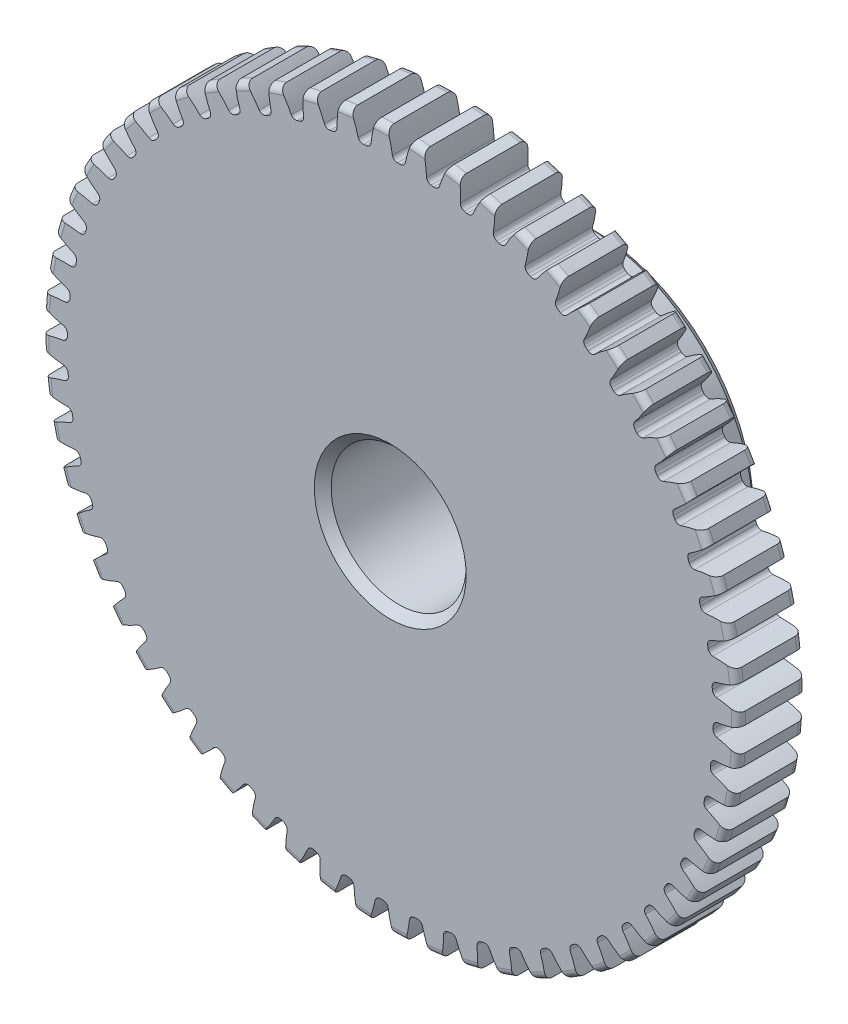
from build123d import *
from OCP.BRepAlgoAPI import BRepAlgoAPI_Cut
from OCP.TopTools import TopTools_ListOfShape

# Parameters (mm, degrees)
SKETCH1_R           = 16.383
BOSS_EXTRUDE1_DEPTH = 3.175
SKETCH2_W           = 6.35
SKETCH2_H           = 7.9375
FILLET2_R           = 0.32766
CUT_EXTRUDE1_DEPTH  = 26.050568981
FILLET1_R           = 0.2493645
CIRPATTERN1_START   = -4
CIRPATTERN1_DEPTH   = 5
SKETCH5_R           = 3.175
CUT_EXTRUDE2_DEPTH  = 26.049683755
CHAMFER1_SIZE       = 0.396875


with BuildPart() as part:
    # Sketch1 → Boss-Extrude1 (new body)
    with BuildSketch(Plane.XY):
        Circle(SKETCH1_R)
    extrude(amount=-BOSS_EXTRUDE1_DEPTH)

    # Sketch2 → Revolve1 (revolve)
    with BuildSketch(Plane(origin=(0, 0, 0), x_dir=(0, 0, -1), z_dir=(1, 0, 0)), mode=Mode.PRIVATE) as revolve1_sk:
        with Locations((6.35, 3.96875)):
            Rectangle(SKETCH2_W, SKETCH2_H)
    revolve(revolve1_sk.sketch.rotate(Axis((0, 0, -3.175), (0, 0, -1)), 90), axis=Axis((0, 0, -3.175), (0, 0, -1)))

    # Fillet2
    fillet2_edges = [part.edges().sort_by_distance(p)[0] for p in [
        (-16.383, 0, 0),
        (-16.383, 0, -3.175),
        (-7.9375, 0, -3.175),
    ]]
    fillet(fillet2_edges, radius=FILLET2_R)

    # Sketch4 → Cut-Extrude1 (cut, through all)
    with BuildSketch(Plane.XY):
        with BuildLine():
            Line((0.099855881, 15.369019402), (0.099855881, 15.192046832))
            ThreePointArc((0.099855881, 15.192046832), (0.397690945, 15.187168928), (0.695373125, 15.176452628))
            Line((0.695373125, 15.176452628), (0.704635175, 15.353182661))
            add(Edge.make_bspline(
                [(2.551287118, 18.556321877), (1.080582249, 17.17635081), (0.704635175, 15.353182661)],
                knots=[0, 0, 0, 1, 1, 1], degree=2))
            ThreePointArc((2.551287118, 18.556321877), (0.490318621, 18.72446889), (-1.576625532, 18.664415327))
            add(Edge.make_bspline(
                [(-1.576625532, 18.664415327), (-0.180158497, 17.209364545), (0.099855881, 15.369019402)],
                knots=[0, 0, 0, 1, 1, 1], degree=2))
        make_face()
    extrude(amount=-CUT_EXTRUDE1_DEPTH, mode=Mode.SUBTRACT)

    # Fillet1
    # the kernel refuses this fillet: 0.2493645 mm, written as the material it adds along each edge
    with BuildSketch(Plane(origin=(0.695373125, 15.176452628, 0), x_dir=(0.05233607851531666, 0.9986295283465428, 0), z_dir=(0, 0, -1))) as fillet1_piece_1:
        with BuildLine():
            CenterArc((0.24596039, -0.239631664), FILLET1_R, 106.060638115, 72.679609329)
            Line((-0.003343838, -0.234149371), (-0.008329923, -0.234039725))
            ThreePointArc((-0.008329923, -0.234039725), (-0.006207551, -0.117009913), (-0.004987182, 3.278e-05))
            Line((-0.004987182, 3.278e-05), (0, 0.00498729))
            ThreePointArc((0, 0.00498729), (0.088486285, 0.00498729), (0.175592813, 0.004792633))
            Line((0.175592813, 0.004792633), (0.17697257, 0))
        make_face()
    extrude(amount=3.175)
    with BuildSketch(Plane(origin=(0.099855881, 15.192046832, 0), x_dir=(0, 1, 0), z_dir=(0, 0, -1))) as fillet1_piece_2:
        with BuildLine():
            CenterArc((0.24596039, 0.239631664), FILLET1_R, 181.259752555, 72.679609329)
            Line((-0.003343838, 0.234149371), (-0.008329923, 0.234039725))
            ThreePointArc((-0.008329923, 0.234039725), (-0.006207551, 0.117009913), (-0.004987182, -3.278e-05))
            Line((-0.004987182, -3.278e-05), (0, -0.00498729))
            ThreePointArc((0, -0.00498729), (0.088486285, -0.00498729), (0.175592813, -0.004792633))
            Line((0.175592813, -0.004792633), (0.17697257, 0))
        make_face()
    extrude(amount=3.175)


with BuildPart() as cirpattern1_tool:
    # CirPattern1: read off the stored shape, not the designer's step
    # CirPattern1 outline → CirPattern1 (new body)
    with BuildSketch(Plane.XY.offset(CIRPATTERN1_START)):
        with BuildLine():
            ThreePointArc((-1.128460949, 15.150407058), (-0.984704773, 15.209746121), (-0.90406948, 15.342730752))
            add(Edge.make_bspline(
                [(-0.90406948, 15.342730752), (-0.85205746, 15.868335896), (-0.708667271, 16.367669957)],
                knots=[0, 0, 0, 0.283730871, 0.283730871, 0.283730871], degree=2))
            ThreePointArc((-0.708667271, 16.367669957), (-1.285394365, 16.332496756), (-1.860522814, 16.277012742))
            add(Edge.make_bspline(
                [(-1.860522814, 16.277012742), (-1.640785483, 15.806261703), (-1.50719112, 15.295264087)],
                knots=[0.716269129, 0.716269129, 0.716269129, 1, 1, 1], degree=2))
            ThreePointArc((-1.50719112, 15.295264087), (-1.406745216, 15.176530844), (-1.255476247, 15.140410745))
            ThreePointArc((-1.255476247, 15.140410745), (-1.191979077, 15.145542051), (-1.128460949, 15.150407058))
        make_face()
        with BuildLine():
            add(Edge.make_bspline(
                [(2.3056197, 15.195421888), (2.465774586, 15.698727391), (2.709848744, 16.157337308)],
                knots=[0, 0, 0, 0.283730871, 0.283730871, 0.283730871], degree=2))
            ThreePointArc((2.709848744, 16.157337308), (2.138411602, 16.242841034), (1.564315314, 16.308145407))
            add(Edge.make_bspline(
                [(1.564315314, 16.308145407), (1.681376213, 15.801995445), (1.70580884, 15.274388524)],
                knots=[0.716269129, 0.716269129, 0.716269129, 1, 1, 1], degree=2))
            ThreePointArc((1.70580884, 15.274388524), (1.77937373, 15.137366009), (1.919827319, 15.070584634))
            ThreePointArc((1.919827319, 15.070584634), (1.983003782, 15.062402004), (2.046145378, 15.053954538))
            ThreePointArc((2.046145378, 15.053954538), (2.199097422, 15.08210831), (2.3056197, 15.195421888))
        make_face()
        with BuildLine():
            add(Edge.make_bspline(
                [(3.881343372, 14.871176893), (4.093230665, 15.354984492), (4.383905549, 15.785569399)],
                knots=[0, 0, 0, 0.283730871, 0.283730871, 0.283730871], degree=2))
            ThreePointArc((4.383905549, 15.785569399), (3.824536372, 15.930336174), (3.26041121, 16.055292205))
            add(Edge.make_bspline(
                [(3.26041121, 16.055292205), (3.323923758, 15.539678789), (3.2930726, 15.012408248)],
                knots=[0.716269129, 0.716269129, 0.716269129, 1, 1, 1], degree=2))
            ThreePointArc((3.2930726, 15.012408248), (3.351911742, 14.868446732), (3.484615356, 14.787349795))
            ThreePointArc((3.484615356, 14.787349795), (3.546590414, 14.772608252), (3.608503113, 14.757606968))
            ThreePointArc((3.608503113, 14.757606968), (3.76356014, 14.769618669), (3.881343372, 14.871176893))
        make_face()
        with BuildLine():
            add(Edge.make_bspline(
                [(5.414542235, 14.384000172), (5.675840451, 14.843009169), (6.009931367, 15.240851488)],
                knots=[0, 0, 0, 0.283730871, 0.283730871, 0.283730871], degree=2))
            ThreePointArc((6.009931367, 15.240851488), (5.468758721, 15.443295217), (4.920785358, 15.626533862))
            add(Edge.make_bspline(
                [(4.920785358, 15.626533862), (4.9300537, 15.10710616), (4.844256768, 14.585948887)],
                knots=[0.716269129, 0.716269129, 0.716269129, 1, 1, 1], degree=2))
            ThreePointArc((4.844256768, 14.585948887), (4.887725507, 14.436625642), (5.011225219, 14.342101657))
            ThreePointArc((5.011225219, 14.342101657), (5.07131986, 14.320962713), (5.131325334, 14.299571968))
            ThreePointArc((5.131325334, 14.299571968), (5.286788507, 14.295309995), (5.414542235, 14.384000172))
        make_face()
        with BuildLine():
            add(Edge.make_bspline(
                [(6.88841824, 13.739229335), (7.196264542, 14.168410732), (7.570111119, 14.529151619)],
                knots=[0, 0, 0, 0.283730871, 0.283730871, 0.283730871], degree=2))
            ThreePointArc((7.570111119, 14.529151619), (7.053064206, 14.787054285), (6.527246352, 15.026567944))
            add(Edge.make_bspline(
                [(6.527246352, 15.026567944), (6.482168941, 14.509016915), (6.342366245, 13.999682817)],
                knots=[0.716269129, 0.716269129, 0.716269129, 1, 1, 1], degree=2))
            ThreePointArc((6.342366245, 13.999682817), (6.369988328, 13.84663386), (6.482931049, 13.739718453))
            ThreePointArc((6.482931049, 13.739718453), (6.540486864, 13.712413709), (6.59792768, 13.684867865))
            ThreePointArc((6.59792768, 13.684867865), (6.752093712, 13.664378913), (6.88841824, 13.739229335))
        make_face()
        with BuildLine():
            add(Edge.make_bspline(
                [(8.286823293, 12.943928626), (8.637844853, 13.338580221), (9.047351149, 13.658267324)],
                knots=[0, 0, 0, 0.283730871, 0.283730871, 0.283730871], degree=2))
            ThreePointArc((9.047351149, 13.658267324), (8.560094843, 13.968803293), (8.062193469, 14.261967803))
            add(Edge.make_bspline(
                [(8.062193469, 14.261967803), (7.963264183, 13.751963844), (7.77098743, 13.260033293)],
                knots=[0.716269129, 0.716269129, 0.716269129, 1, 1, 1], degree=2))
            ThreePointArc((7.77098743, 13.260033293), (7.782460224, 13.10493546), (7.88360853, 12.986800017))
            ThreePointArc((7.88360853, 12.986800017), (7.937994925, 12.953628631), (7.992241749, 12.920229486))
            ThreePointArc((7.992241749, 12.920229486), (8.143421565, 12.883738036), (8.286823293, 12.943928626))
        make_face()
        with BuildLine():
            add(Edge.make_bspline(
                [(9.594436176, 12.006811527), (9.984787128, 12.362609435), (10.425466507, 12.637740194)],
                knots=[0, 0, 0, 0.283730871, 0.283730871, 0.283730871], degree=2))
            ThreePointArc((10.425466507, 12.637740194), (9.973339291, 12.997507168), (9.508809508, 13.341110558))
            add(Edge.make_bspline(
                [(9.508809508, 13.341110558), (9.357112236, 12.84424138), (9.114468051, 12.375104069)],
                knots=[0.716269129, 0.716269129, 0.716269129, 1, 1, 1], degree=2))
            ThreePointArc((9.114468051, 12.375104069), (9.109665858, 12.219656645), (9.197911546, 12.091595483))
            ThreePointArc((9.197911546, 12.091595483), (9.248532653, 12.052920887), (9.298991146, 12.014034368))
            ThreePointArc((9.298991146, 12.014034368), (9.445528388, 11.961940229), (9.594436176, 12.006811527))
        make_face()
        with BuildLine():
            add(Edge.make_bspline(
                [(10.796930408, 10.938145288), (11.222333985, 11.251191312), (11.689358273, 11.478751338)],
                knots=[0, 0, 0, 0.283730871, 0.283730871, 0.283730871], degree=2))
            ThreePointArc((11.689358273, 11.478751338), (11.277313746, 11.883807635), (10.85124504, 12.274085314))
            add(Edge.make_bspline(
                [(10.85124504, 12.274085314), (10.648441809, 11.795794719), (10.358088652, 11.354590615)],
                knots=[0.716269129, 0.716269129, 0.716269129, 1, 1, 1], degree=2))
            ThreePointArc((10.358088652, 11.354590615), (10.337064086, 11.200496714), (10.411440319, 11.063912899))
            ThreePointArc((10.411440319, 11.063912899), (10.457741522, 11.02015882), (10.50385885, 10.976210977))
            ThreePointArc((10.50385885, 10.976210977), (10.644148025, 10.909084901), (10.796930408, 10.938145288))
        make_face()
        with BuildLine():
            add(Edge.make_bspline(
                [(11.881131211, 9.74963844), (12.336926603, 10.016502783), (12.825178982, 10.193998881)],
                knots=[0, 0, 0, 0.283730871, 0.283730871, 0.283730871], degree=2))
            ThreePointArc((12.825178982, 10.193998881), (12.457731591, 10.639906618), (12.074792061, 11.072582622))
            add(Edge.make_bspline(
                [(12.074792061, 11.072582622), (11.823104826, 10.618110863), (11.488223867, 10.20967389)],
                knots=[0.716269129, 0.716269129, 0.716269129, 1, 1, 1], degree=2))
            ThreePointArc((11.488223867, 10.20967389), (11.451207276, 10.058621797), (11.510899172, 9.915011769))
            ThreePointArc((11.510899172, 9.915011769), (11.552373186, 9.866657586), (11.593644078, 9.818129921))
            ThreePointArc((11.593644078, 9.818129921), (11.726148148, 9.736707357), (11.881131211, 9.74963844))
        make_face()
        with BuildLine():
            add(Edge.make_bspline(
                [(12.835159855, 8.454312513), (13.316353272, 8.672071354), (13.820484348, 8.797558838)],
                knots=[0, 0, 0, 0.283730871, 0.283730871, 0.283730871], degree=2))
            ThreePointArc((13.820484348, 8.797558838), (13.501659923, 9.279432557), (13.166045133, 9.749766398))
            add(Edge.make_bspline(
                [(13.166045133, 9.749766398), (12.868231432, 9.324092762), (12.492491697, 8.952897842)],
                knots=[0.716269129, 0.716269129, 0.716269129, 1, 1, 1], degree=2))
            ThreePointArc((12.492491697, 8.952897842), (12.439888644, 8.806542516), (12.484242206, 8.657479696))
            ThreePointArc((12.484242206, 8.657479696), (12.520434632, 8.605055187), (12.556406915, 8.552479378))
            ThreePointArc((12.556406915, 8.552479378), (12.679674139, 8.457652409), (12.835159855, 8.454312513))
        make_face()
        with BuildLine():
            add(Edge.make_bspline(
                [(13.648563801, 7.066359369), (14.149883187, 7.232626896), (14.664369594, 7.3047309)],
                knots=[0, 0, 0, 0.283730871, 0.283730871, 0.283730871], degree=2))
            ThreePointArc((14.664369594, 7.3047309), (14.397661243, 7.817291092), (14.113048259, 8.320129692))
            add(Edge.make_bspline(
                [(14.113048259, 8.320129692), (13.772371002, 7.927917949), (13.359889173, 7.598031971)],
                knots=[0.716269129, 0.716269129, 0.716269129, 1, 1, 1], degree=2))
            ThreePointArc((13.359889173, 7.598031971), (13.292275988, 7.457976911), (13.320805269, 7.305094464))
            ThreePointArc((13.320805269, 7.305094464), (13.351319576, 7.249174003), (13.381599131, 7.193126083))
            ThreePointArc((13.381599131, 7.193126083), (13.494278967, 7.085933652), (13.648563801, 7.066359369))
        make_face()
        with BuildLine():
            add(Edge.make_bspline(
                [(14.312431226, 5.600985713), (14.828384021, 5.713940264), (15.347588939, 5.731870801)],
                knots=[0, 0, 0, 0.283730871, 0.283730871, 0.283730871], degree=2))
            ThreePointArc((15.347588939, 5.731870801), (15.135918773, 6.269501749), (14.905425876, 6.799335905))
            add(Edge.make_bspline(
                [(14.905425876, 6.799335905), (14.525617592, 6.444883209), (14.080912909, 6.159920473)],
                knots=[0.716269129, 0.716269129, 0.716269129, 1, 1, 1], degree=2))
            ThreePointArc((14.080912909, 6.159920473), (13.999030375, 6.027700152), (14.011422802, 5.872673088))
            ThreePointArc((14.011422802, 5.872673088), (14.035924669, 5.813869352), (14.060179746, 5.754963392))
            ThreePointArc((14.060179746, 5.754963392), (14.16103765, 5.636579923), (14.312431226, 5.600985713))
        make_face()
        with BuildLine():
            add(Edge.make_bspline(
                [(14.81948866, 4.074246485), (15.344421977, 4.132650507), (15.862656887, 4.096211126)],
                knots=[0, 0, 0, 0.283730871, 0.283730871, 0.283730871], degree=2))
            ThreePointArc((15.862656887, 4.096211126), (15.70834401, 4.653022433), (15.534496527, 5.204047171))
            add(Edge.make_bspline(
                [(15.534496527, 5.204047171), (15.119718477, 4.89123698), (14.647663215, 4.654319596)],
                knots=[0.716269129, 0.716269129, 0.716269129, 1, 1, 1], degree=2))
            ThreePointArc((14.647663215, 4.654319596), (14.552408456, 4.531382646), (14.548528255, 4.375909476))
            ThreePointArc((14.548528255, 4.375909476), (14.566749234, 4.314866731), (14.58471409, 4.253748118))
            ThreePointArc((14.58471409, 4.253748118), (14.672645042, 4.125470644), (14.81948866, 4.074246485))
        make_face()
        with BuildLine():
            add(Edge.make_bspline(
                [(15.164180675, 2.502868961), (15.692343235, 2.506082566), (16.203930247, 2.415672505)],
                knots=[0, 0, 0, 0.283730871, 0.283730871, 0.283730871], degree=2))
            ThreePointArc((16.203930247, 2.415672505), (16.108665343, 2.98556363), (15.993367984, 3.551741806))
            add(Edge.make_bspline(
                [(15.993367984, 3.551741806), (15.548164562, 3.284001334), (15.053930658, 3.09772502)],
                knots=[0.716269129, 0.716269129, 0.716269129, 1, 1, 1], degree=2))
            ThreePointArc((15.053930658, 3.09772502), (14.946347304, 2.985418366), (14.926236988, 2.831202485))
            ThreePointArc((14.926236988, 2.831202485), (14.937977446, 2.768589527), (14.949455254, 2.70592789))
            ThreePointArc((14.949455254, 2.70592789), (15.023495864, 2.569161846), (15.164180675, 2.502868961))
        make_face()
        with BuildLine():
            add(Edge.make_bspline(
                [(15.342730752, 0.90406948), (15.868335896, 0.85205746), (16.367669957, 0.708667271)],
                knots=[0, 0, 0, 0.283730871, 0.283730871, 0.283730871], degree=2))
            ThreePointArc((16.367669957, 0.708667271), (16.332496767, 1.285394366), (16.277012753, 1.860522815))
            add(Edge.make_bspline(
                [(16.277012753, 1.860522815), (15.806261703, 1.640785483), (15.295264087, 1.50719112)],
                knots=[0.716269129, 0.716269129, 0.716269129, 1, 1, 1], degree=2))
            ThreePointArc((15.295264087, 1.50719112), (15.176530844, 1.406745216), (15.140410745, 1.255476247))
            ThreePointArc((15.140410745, 1.255476247), (15.145542051, 1.191979078), (15.150407058, 1.12846095))
            ThreePointArc((15.150407058, 1.12846095), (15.209746121, 0.984704773), (15.342730752, 0.90406948))
        make_face()
        with BuildLine():
            add(Edge.make_bspline(
                [(15.353182661, -0.704635175), (15.870471748, -0.811302966), (16.352082049, -1.00610227)],
                knots=[0, 0, 0, 0.283730871, 0.283730871, 0.283730871], degree=2))
            ThreePointArc((16.352082049, -1.00610227), (16.377385939, -0.428857947), (16.382323165, 0.148919547))
            add(Edge.make_bspline(
                [(16.382323165, 0.148919547), (15.891182132, -0.020407157), (15.369019402, -0.099855881)],
                knots=[0.716269129, 0.716269129, 0.716269129, 1, 1, 1], degree=2))
            ThreePointArc((15.369019402, -0.099855881), (15.240437136, -0.187340528), (15.188702994, -0.334005252))
            ThreePointArc((15.188702994, -0.334005252), (15.187168928, -0.397690945), (15.185367832, -0.461369645))
            ThreePointArc((15.185367832, -0.461369645), (15.229355217, -0.610540931), (15.353182661, -0.704635175))
        make_face()
        with BuildLine():
            add(Edge.make_bspline(
                [(15.195421888, -2.3056197), (15.698727391, -2.465774586), (16.157337308, -2.709848744)],
                knots=[0, 0, 0, 0.283730871, 0.283730871, 0.283730871], degree=2))
            ThreePointArc((16.157337308, -2.709848744), (16.242841043, -2.138411603), (16.308145416, -1.564315315))
            add(Edge.make_bspline(
                [(16.308145416, -1.564315315), (15.801995445, -1.681376213), (15.274388524, -1.70580884)],
                knots=[0.716269129, 0.716269129, 0.716269129, 1, 1, 1], degree=2))
            ThreePointArc((15.274388524, -1.70580884), (15.137366009, -1.77937373), (15.070584634, -1.919827319))
            ThreePointArc((15.070584634, -1.919827319), (15.062402004, -1.983003782), (15.053954538, -2.046145378))
            ThreePointArc((15.053954538, -2.046145378), (15.08210831, -2.199097422), (15.195421888, -2.3056197))
        make_face()
        with BuildLine():
            add(Edge.make_bspline(
                [(14.871176893, -3.881343372), (15.354984492, -4.093230665), (15.785569399, -4.383905549)],
                knots=[0, 0, 0, 0.283730871, 0.283730871, 0.283730871], degree=2))
            ThreePointArc((15.785569399, -4.383905549), (15.930336181, -3.824536374), (16.055292213, -3.260411211))
            add(Edge.make_bspline(
                [(16.055292213, -3.260411211), (15.539678789, -3.323923758), (15.012408248, -3.2930726)],
                knots=[0.716269129, 0.716269129, 0.716269129, 1, 1, 1], degree=2))
            ThreePointArc((15.012408248, -3.2930726), (14.868446732, -3.351911742), (14.787349795, -3.484615356))
            ThreePointArc((14.787349795, -3.484615356), (14.772608252, -3.546590414), (14.757606968, -3.608503113))
            ThreePointArc((14.757606968, -3.608503113), (14.769618669, -3.76356014), (14.871176893, -3.881343372))
        make_face()
        with BuildLine():
            add(Edge.make_bspline(
                [(14.384000172, -5.414542235), (14.843009169, -5.675840451), (15.240851488, -6.009931367)],
                knots=[0, 0, 0, 0.283730871, 0.283730871, 0.283730871], degree=2))
            ThreePointArc((15.240851488, -6.009931367), (15.443295223, -5.468758723), (15.626533869, -4.92078536))
            add(Edge.make_bspline(
                [(15.626533869, -4.92078536), (15.10710616, -4.9300537), (14.585948887, -4.844256768)],
                knots=[0.716269129, 0.716269129, 0.716269129, 1, 1, 1], degree=2))
            ThreePointArc((14.585948887, -4.844256768), (14.436625642, -4.887725507), (14.342101657, -5.011225219))
            ThreePointArc((14.342101657, -5.011225219), (14.320962713, -5.07131986), (14.299571968, -5.131325334))
            ThreePointArc((14.299571968, -5.131325334), (14.295309995, -5.286788507), (14.384000172, -5.414542235))
        make_face()
        with BuildLine():
            add(Edge.make_bspline(
                [(13.739229335, -6.88841824), (14.168410732, -7.196264542), (14.529151619, -7.570111119)],
                knots=[0, 0, 0, 0.283730871, 0.283730871, 0.283730871], degree=2))
            ThreePointArc((14.529151619, -7.570111119), (14.78705429, -7.053064208), (15.026567949, -6.527246354))
            add(Edge.make_bspline(
                [(15.026567949, -6.527246354), (14.509016915, -6.482168941), (13.999682817, -6.342366245)],
                knots=[0.716269129, 0.716269129, 0.716269129, 1, 1, 1], degree=2))
            ThreePointArc((13.999682817, -6.342366245), (13.84663386, -6.369988328), (13.739718453, -6.482931049))
            ThreePointArc((13.739718453, -6.482931049), (13.712413709, -6.540486864), (13.684867865, -6.59792768))
            ThreePointArc((13.684867865, -6.59792768), (13.664378913, -6.752093712), (13.739229335, -6.88841824))
        make_face()
        with BuildLine():
            add(Edge.make_bspline(
                [(12.943928626, -8.286823293), (13.338580221, -8.637844853), (13.658267324, -9.047351149)],
                knots=[0, 0, 0, 0.283730871, 0.283730871, 0.283730871], degree=2))
            ThreePointArc((13.658267324, -9.047351149), (13.968803296, -8.560094845), (14.261967807, -8.062193472))
            add(Edge.make_bspline(
                [(14.261967807, -8.062193472), (13.751963844, -7.963264183), (13.260033293, -7.77098743)],
                knots=[0.716269129, 0.716269129, 0.716269129, 1, 1, 1], degree=2))
            ThreePointArc((13.260033293, -7.77098743), (13.10493546, -7.782460224), (12.986800017, -7.88360853))
            ThreePointArc((12.986800017, -7.88360853), (12.953628631, -7.937994925), (12.920229486, -7.992241749))
            ThreePointArc((12.920229486, -7.992241749), (12.883738036, -8.143421565), (12.943928626, -8.286823293))
        make_face()
        with BuildLine():
            add(Edge.make_bspline(
                [(12.006811527, -9.594436176), (12.362609435, -9.984787128), (12.637740194, -10.425466507)],
                knots=[0, 0, 0, 0.283730871, 0.283730871, 0.283730871], degree=2))
            ThreePointArc((12.637740194, -10.425466507), (12.99750717, -9.973339292), (13.34111056, -9.50880951))
            add(Edge.make_bspline(
                [(13.34111056, -9.50880951), (12.84424138, -9.357112236), (12.375104069, -9.114468051)],
                knots=[0.716269129, 0.716269129, 0.716269129, 1, 1, 1], degree=2))
            ThreePointArc((12.375104069, -9.114468051), (12.219656645, -9.109665858), (12.091595483, -9.197911546))
            ThreePointArc((12.091595483, -9.197911546), (12.052920887, -9.248532653), (12.014034368, -9.298991146))
            ThreePointArc((12.014034368, -9.298991146), (11.961940229, -9.445528388), (12.006811527, -9.594436176))
        make_face()
        with BuildLine():
            add(Edge.make_bspline(
                [(10.938145288, -10.796930408), (11.251191312, -11.222333985), (11.478751338, -11.689358273)],
                knots=[0, 0, 0, 0.283730871, 0.283730871, 0.283730871], degree=2))
            ThreePointArc((11.478751338, -11.689358273), (11.883807635, -11.277313746), (12.274085315, -10.851245041))
            add(Edge.make_bspline(
                [(12.274085315, -10.851245041), (11.795794719, -10.648441809), (11.354590615, -10.358088652)],
                knots=[0.716269129, 0.716269129, 0.716269129, 1, 1, 1], degree=2))
            ThreePointArc((11.354590615, -10.358088652), (11.200496714, -10.337064086), (11.063912899, -10.411440319))
            ThreePointArc((11.063912899, -10.411440319), (11.02015882, -10.457741522), (10.976210977, -10.50385885))
            ThreePointArc((10.976210977, -10.50385885), (10.909084901, -10.644148025), (10.938145288, -10.796930408))
        make_face()
        with BuildLine():
            add(Edge.make_bspline(
                [(9.74963844, -11.881131211), (10.016502783, -12.336926603), (10.193998881, -12.825178982)],
                knots=[0, 0, 0, 0.283730871, 0.283730871, 0.283730871], degree=2))
            ThreePointArc((10.193998881, -12.825178982), (10.639906618, -12.457731591), (11.072582622, -12.074792061))
            add(Edge.make_bspline(
                [(11.072582622, -12.074792061), (10.618110863, -11.823104826), (10.20967389, -11.488223867)],
                knots=[0.716269129, 0.716269129, 0.716269129, 1, 1, 1], degree=2))
            ThreePointArc((10.20967389, -11.488223867), (10.058621797, -11.451207276), (9.915011769, -11.510899172))
            ThreePointArc((9.915011769, -11.510899172), (9.866657586, -11.552373186), (9.818129921, -11.593644078))
            ThreePointArc((9.818129921, -11.593644078), (9.736707357, -11.726148148), (9.74963844, -11.881131211))
        make_face()
        with BuildLine():
            add(Edge.make_bspline(
                [(8.454312513, -12.835159855), (8.672071354, -13.316353272), (8.797558838, -13.820484348)],
                knots=[0, 0, 0, 0.283730871, 0.283730871, 0.283730871], degree=2))
            ThreePointArc((8.797558838, -13.820484348), (9.279432556, -13.501659921), (9.749766397, -13.166045132))
            add(Edge.make_bspline(
                [(9.749766397, -13.166045132), (9.324092762, -12.868231432), (8.952897842, -12.492491697)],
                knots=[0.716269129, 0.716269129, 0.716269129, 1, 1, 1], degree=2))
            ThreePointArc((8.952897842, -12.492491697), (8.806542516, -12.439888644), (8.657479696, -12.484242206))
            ThreePointArc((8.657479696, -12.484242206), (8.605055187, -12.520434632), (8.552479378, -12.556406915))
            ThreePointArc((8.552479378, -12.556406915), (8.457652409, -12.679674139), (8.454312513, -12.835159855))
        make_face()
        with BuildLine():
            add(Edge.make_bspline(
                [(7.066359369, -13.648563801), (7.232626896, -14.149883187), (7.3047309, -14.664369594)],
                knots=[0, 0, 0, 0.283730871, 0.283730871, 0.283730871], degree=2))
            ThreePointArc((7.3047309, -14.664369594), (7.81729109, -14.39766124), (8.320129691, -14.113048257))
            add(Edge.make_bspline(
                [(8.320129691, -14.113048257), (7.927917949, -13.772371002), (7.598031971, -13.359889173)],
                knots=[0.716269129, 0.716269129, 0.716269129, 1, 1, 1], degree=2))
            ThreePointArc((7.598031971, -13.359889173), (7.457976911, -13.292275988), (7.305094464, -13.320805269))
            ThreePointArc((7.305094464, -13.320805269), (7.249174003, -13.351319576), (7.193126083, -13.381599131))
            ThreePointArc((7.193126083, -13.381599131), (7.085933652, -13.494278967), (7.066359369, -13.648563801))
        make_face()
        with BuildLine():
            add(Edge.make_bspline(
                [(5.600985713, -14.312431226), (5.713940264, -14.828384021), (5.731870801, -15.347588939)],
                knots=[0, 0, 0, 0.283730871, 0.283730871, 0.283730871], degree=2))
            ThreePointArc((5.731870801, -15.347588939), (6.269501747, -15.135918769), (6.799335903, -14.905425872))
            add(Edge.make_bspline(
                [(6.799335903, -14.905425872), (6.444883209, -14.525617592), (6.159920473, -14.080912909)],
                knots=[0.716269129, 0.716269129, 0.716269129, 1, 1, 1], degree=2))
            ThreePointArc((6.159920473, -14.080912909), (6.027700152, -13.999030375), (5.872673088, -14.011422802))
            ThreePointArc((5.872673088, -14.011422802), (5.813869352, -14.035924669), (5.754963392, -14.060179746))
            ThreePointArc((5.754963392, -14.060179746), (5.636579923, -14.16103765), (5.600985713, -14.312431226))
        make_face()
        with BuildLine():
            add(Edge.make_bspline(
                [(4.074246485, -14.81948866), (4.132650507, -15.344421977), (4.096211126, -15.862656887)],
                knots=[0, 0, 0, 0.283730871, 0.283730871, 0.283730871], degree=2))
            ThreePointArc((4.096211126, -15.862656887), (4.653022432, -15.708344004), (5.204047169, -15.534496522))
            add(Edge.make_bspline(
                [(5.204047169, -15.534496522), (4.89123698, -15.119718477), (4.654319596, -14.647663215)],
                knots=[0.716269129, 0.716269129, 0.716269129, 1, 1, 1], degree=2))
            ThreePointArc((4.654319596, -14.647663215), (4.531382646, -14.552408456), (4.375909476, -14.548528255))
            ThreePointArc((4.375909476, -14.548528255), (4.314866731, -14.566749234), (4.253748118, -14.58471409))
            ThreePointArc((4.253748118, -14.58471409), (4.125470644, -14.672645042), (4.074246485, -14.81948866))
        make_face()
        with BuildLine():
            add(Edge.make_bspline(
                [(2.502868961, -15.164180675), (2.506082566, -15.692343235), (2.415672505, -16.203930247)],
                knots=[0, 0, 0, 0.283730871, 0.283730871, 0.283730871], degree=2))
            ThreePointArc((2.415672505, -16.203930247), (2.985563628, -16.108665336), (3.551741805, -15.993367977))
            add(Edge.make_bspline(
                [(3.551741805, -15.993367977), (3.284001334, -15.548164562), (3.09772502, -15.053930658)],
                knots=[0.716269129, 0.716269129, 0.716269129, 1, 1, 1], degree=2))
            ThreePointArc((3.09772502, -15.053930658), (2.985418366, -14.946347304), (2.831202485, -14.926236988))
            ThreePointArc((2.831202485, -14.926236988), (2.768589527, -14.937977446), (2.70592789, -14.949455254))
            ThreePointArc((2.70592789, -14.949455254), (2.569161846, -15.023495864), (2.502868961, -15.164180675))
        make_face()
        with BuildLine():
            add(Edge.make_bspline(
                [(0.90406948, -15.342730752), (0.85205746, -15.868335896), (0.708667271, -16.367669957)],
                knots=[0, 0, 0, 0.283730871, 0.283730871, 0.283730871], degree=2))
            ThreePointArc((0.708667271, -16.367669957), (1.285394366, -16.332496758), (1.860522814, -16.277012745))
            add(Edge.make_bspline(
                [(1.860522814, -16.277012745), (1.640785483, -15.806261703), (1.50719112, -15.295264087)],
                knots=[0.716269129, 0.716269129, 0.716269129, 1, 1, 1], degree=2))
            ThreePointArc((1.50719112, -15.295264087), (1.406745216, -15.176530844), (1.255476247, -15.140410745))
            ThreePointArc((1.255476247, -15.140410745), (1.191979077, -15.145542051), (1.128460949, -15.150407058))
            ThreePointArc((1.128460949, -15.150407058), (0.984704773, -15.209746121), (0.90406948, -15.342730752))
        make_face()
        with BuildLine():
            add(Edge.make_bspline(
                [(-0.704635175, -15.353182661), (-0.811302966, -15.870471748), (-1.00610227, -16.352082049)],
                knots=[0, 0, 0, 0.283730871, 0.283730871, 0.283730871], degree=2))
            ThreePointArc((-1.00610227, -16.352082049), (-0.428857947, -16.377385929), (0.148919547, -16.382323156))
            add(Edge.make_bspline(
                [(0.148919547, -16.382323156), (-0.020407157, -15.891182132), (-0.099855881, -15.369019402)],
                knots=[0.716269129, 0.716269129, 0.716269129, 1, 1, 1], degree=2))
            ThreePointArc((-0.099855881, -15.369019402), (-0.187340528, -15.240437136), (-0.334005252, -15.188702994))
            ThreePointArc((-0.334005252, -15.188702994), (-0.397690945, -15.187168928), (-0.461369645, -15.185367832))
            ThreePointArc((-0.461369645, -15.185367832), (-0.610540931, -15.229355217), (-0.704635175, -15.353182661))
        make_face()
        with BuildLine():
            add(Edge.make_bspline(
                [(-2.3056197, -15.195421888), (-2.465774586, -15.698727391), (-2.709848744, -16.157337308)],
                knots=[0, 0, 0, 0.283730871, 0.283730871, 0.283730871], degree=2))
            ThreePointArc((-2.709848744, -16.157337308), (-2.138411601, -16.242841032), (-1.564315314, -16.308145406))
            add(Edge.make_bspline(
                [(-1.564315314, -16.308145406), (-1.681376213, -15.801995445), (-1.70580884, -15.274388524)],
                knots=[0.716269129, 0.716269129, 0.716269129, 1, 1, 1], degree=2))
            ThreePointArc((-1.70580884, -15.274388524), (-1.77937373, -15.137366009), (-1.919827319, -15.070584634))
            ThreePointArc((-1.919827319, -15.070584634), (-1.983003782, -15.062402004), (-2.046145378, -15.053954538))
            ThreePointArc((-2.046145378, -15.053954538), (-2.199097422, -15.08210831), (-2.3056197, -15.195421888))
        make_face()
        with BuildLine():
            add(Edge.make_bspline(
                [(-3.881343372, -14.871176893), (-4.093230665, -15.354984492), (-4.383905549, -15.785569399)],
                knots=[0, 0, 0, 0.283730871, 0.283730871, 0.283730871], degree=2))
            ThreePointArc((-4.383905549, -15.785569399), (-3.824536371, -15.93033617), (-3.260411209, -16.055292202))
            add(Edge.make_bspline(
                [(-3.260411209, -16.055292202), (-3.323923758, -15.539678789), (-3.2930726, -15.012408248)],
                knots=[0.716269129, 0.716269129, 0.716269129, 1, 1, 1], degree=2))
            ThreePointArc((-3.2930726, -15.012408248), (-3.351911742, -14.868446732), (-3.484615356, -14.787349795))
            ThreePointArc((-3.484615356, -14.787349795), (-3.546590414, -14.772608252), (-3.608503113, -14.757606968))
            ThreePointArc((-3.608503113, -14.757606968), (-3.76356014, -14.769618669), (-3.881343372, -14.871176893))
        make_face()
        with BuildLine():
            add(Edge.make_bspline(
                [(-5.414542235, -14.384000172), (-5.675840451, -14.843009169), (-6.009931367, -15.240851488)],
                knots=[0, 0, 0, 0.283730871, 0.283730871, 0.283730871], degree=2))
            ThreePointArc((-6.009931367, -15.240851488), (-5.468758719, -15.443295211), (-4.920785356, -15.626533857))
            add(Edge.make_bspline(
                [(-4.920785356, -15.626533857), (-4.9300537, -15.10710616), (-4.844256768, -14.585948887)],
                knots=[0.716269129, 0.716269129, 0.716269129, 1, 1, 1], degree=2))
            ThreePointArc((-4.844256768, -14.585948887), (-4.887725507, -14.436625642), (-5.011225219, -14.342101657))
            ThreePointArc((-5.011225219, -14.342101657), (-5.07131986, -14.320962713), (-5.131325334, -14.299571968))
            ThreePointArc((-5.131325334, -14.299571968), (-5.286788507, -14.295309995), (-5.414542235, -14.384000172))
        make_face()
        with BuildLine():
            add(Edge.make_bspline(
                [(-6.88841824, -13.739229335), (-7.196264542, -14.168410732), (-7.570111119, -14.529151619)],
                knots=[0, 0, 0, 0.283730871, 0.283730871, 0.283730871], degree=2))
            ThreePointArc((-7.570111119, -14.529151619), (-7.053064203, -14.787054278), (-6.527246349, -15.026567938))
            add(Edge.make_bspline(
                [(-6.527246349, -15.026567938), (-6.482168941, -14.509016915), (-6.342366245, -13.999682817)],
                knots=[0.716269129, 0.716269129, 0.716269129, 1, 1, 1], degree=2))
            ThreePointArc((-6.342366245, -13.999682817), (-6.369988328, -13.84663386), (-6.482931049, -13.739718453))
            ThreePointArc((-6.482931049, -13.739718453), (-6.540486864, -13.712413709), (-6.59792768, -13.684867865))
            ThreePointArc((-6.59792768, -13.684867865), (-6.752093712, -13.664378913), (-6.88841824, -13.739229335))
        make_face()
        with BuildLine():
            add(Edge.make_bspline(
                [(-8.286823293, -12.943928626), (-8.637844853, -13.338580221), (-9.047351149, -13.658267324)],
                knots=[0, 0, 0, 0.283730871, 0.283730871, 0.283730871], degree=2))
            ThreePointArc((-9.047351149, -13.658267324), (-8.560094838, -13.968803284), (-8.062193465, -14.261967795))
            add(Edge.make_bspline(
                [(-8.062193465, -14.261967795), (-7.963264183, -13.751963844), (-7.77098743, -13.260033293)],
                knots=[0.716269129, 0.716269129, 0.716269129, 1, 1, 1], degree=2))
            ThreePointArc((-7.77098743, -13.260033293), (-7.782460224, -13.10493546), (-7.88360853, -12.986800017))
            ThreePointArc((-7.88360853, -12.986800017), (-7.937994925, -12.953628631), (-7.992241749, -12.920229486))
            ThreePointArc((-7.992241749, -12.920229486), (-8.143421565, -12.883738036), (-8.286823293, -12.943928626))
        make_face()
        with BuildLine():
            add(Edge.make_bspline(
                [(-9.594436176, -12.006811527), (-9.984787128, -12.362609435), (-10.425466507, -12.637740194)],
                knots=[0, 0, 0, 0.283730871, 0.283730871, 0.283730871], degree=2))
            ThreePointArc((-10.425466507, -12.637740194), (-9.973339284, -12.997507159), (-9.508809502, -13.341110549))
            add(Edge.make_bspline(
                [(-9.508809502, -13.341110549), (-9.357112236, -12.84424138), (-9.114468051, -12.375104069)],
                knots=[0.716269129, 0.716269129, 0.716269129, 1, 1, 1], degree=2))
            ThreePointArc((-9.114468051, -12.375104069), (-9.109665858, -12.219656645), (-9.197911546, -12.091595483))
            ThreePointArc((-9.197911546, -12.091595483), (-9.248532653, -12.052920887), (-9.298991146, -12.014034368))
            ThreePointArc((-9.298991146, -12.014034368), (-9.445528388, -11.961940229), (-9.594436176, -12.006811527))
        make_face()
        with BuildLine():
            add(Edge.make_bspline(
                [(-10.796930408, -10.938145288), (-11.222333985, -11.251191312), (-11.689358273, -11.478751338)],
                knots=[0, 0, 0, 0.283730871, 0.283730871, 0.283730871], degree=2))
            ThreePointArc((-11.689358273, -11.478751338), (-11.277313737, -11.883807625), (-10.851245032, -12.274085304))
            add(Edge.make_bspline(
                [(-10.851245032, -12.274085304), (-10.648441809, -11.795794719), (-10.358088652, -11.354590615)],
                knots=[0.716269129, 0.716269129, 0.716269129, 1, 1, 1], degree=2))
            ThreePointArc((-10.358088652, -11.354590615), (-10.337064086, -11.200496714), (-10.411440319, -11.063912899))
            ThreePointArc((-10.411440319, -11.063912899), (-10.457741522, -11.02015882), (-10.50385885, -10.976210977))
            ThreePointArc((-10.50385885, -10.976210977), (-10.644148025, -10.909084901), (-10.796930408, -10.938145288))
        make_face()
        with BuildLine():
            add(Edge.make_bspline(
                [(-11.881131211, -9.74963844), (-12.336926603, -10.016502783), (-12.825178982, -10.193998881)],
                knots=[0, 0, 0, 0.283730871, 0.283730871, 0.283730871], degree=2))
            ThreePointArc((-12.825178982, -10.193998881), (-12.45773158, -10.639906608), (-12.074792051, -11.072582612))
            add(Edge.make_bspline(
                [(-12.074792051, -11.072582612), (-11.823104826, -10.618110863), (-11.488223867, -10.20967389)],
                knots=[0.716269129, 0.716269129, 0.716269129, 1, 1, 1], degree=2))
            ThreePointArc((-11.488223867, -10.20967389), (-11.451207276, -10.058621797), (-11.510899172, -9.915011769))
            ThreePointArc((-11.510899172, -9.915011769), (-11.552373186, -9.866657586), (-11.593644078, -9.818129921))
            ThreePointArc((-11.593644078, -9.818129921), (-11.726148148, -9.736707357), (-11.881131211, -9.74963844))
        make_face()
        with BuildLine():
            add(Edge.make_bspline(
                [(-12.835159855, -8.454312513), (-13.316353272, -8.672071354), (-13.820484348, -8.797558838)],
                knots=[0, 0, 0, 0.283730871, 0.283730871, 0.283730871], degree=2))
            ThreePointArc((-13.820484348, -8.797558838), (-13.50165991, -9.279432549), (-13.166045121, -9.749766389))
            add(Edge.make_bspline(
                [(-13.166045121, -9.749766389), (-12.868231432, -9.324092762), (-12.492491697, -8.952897842)],
                knots=[0.716269129, 0.716269129, 0.716269129, 1, 1, 1], degree=2))
            ThreePointArc((-12.492491697, -8.952897842), (-12.439888644, -8.806542516), (-12.484242206, -8.657479696))
            ThreePointArc((-12.484242206, -8.657479696), (-12.520434632, -8.605055187), (-12.556406915, -8.552479378))
            ThreePointArc((-12.556406915, -8.552479378), (-12.679674139, -8.457652409), (-12.835159855, -8.454312513))
        make_face()
        with BuildLine():
            add(Edge.make_bspline(
                [(-13.648563801, -7.066359369), (-14.149883187, -7.232626896), (-14.664369594, -7.3047309)],
                knots=[0, 0, 0, 0.283730871, 0.283730871, 0.283730871], degree=2))
            ThreePointArc((-14.664369594, -7.3047309), (-14.397661228, -7.817291084), (-14.113048245, -8.320129684))
            add(Edge.make_bspline(
                [(-14.113048245, -8.320129684), (-13.772371002, -7.927917949), (-13.359889173, -7.598031971)],
                knots=[0.716269129, 0.716269129, 0.716269129, 1, 1, 1], degree=2))
            ThreePointArc((-13.359889173, -7.598031971), (-13.292275988, -7.457976911), (-13.320805269, -7.305094464))
            ThreePointArc((-13.320805269, -7.305094464), (-13.351319576, -7.249174003), (-13.381599131, -7.193126083))
            ThreePointArc((-13.381599131, -7.193126083), (-13.494278967, -7.085933652), (-13.648563801, -7.066359369))
        make_face()
        with BuildLine():
            add(Edge.make_bspline(
                [(-14.312431226, -5.600985713), (-14.828384021, -5.713940264), (-15.347588939, -5.731870801)],
                knots=[0, 0, 0, 0.283730871, 0.283730871, 0.283730871], degree=2))
            ThreePointArc((-15.347588939, -5.731870801), (-15.135918757, -6.269501742), (-14.90542586, -6.799335898))
            add(Edge.make_bspline(
                [(-14.90542586, -6.799335898), (-14.525617592, -6.444883209), (-14.080912909, -6.159920473)],
                knots=[0.716269129, 0.716269129, 0.716269129, 1, 1, 1], degree=2))
            ThreePointArc((-14.080912909, -6.159920473), (-13.999030375, -6.027700152), (-14.011422802, -5.872673088))
            ThreePointArc((-14.011422802, -5.872673088), (-14.035924669, -5.813869352), (-14.060179746, -5.754963392))
            ThreePointArc((-14.060179746, -5.754963392), (-14.16103765, -5.636579923), (-14.312431226, -5.600985713))
        make_face()
        with BuildLine():
            add(Edge.make_bspline(
                [(-14.81948866, -4.074246485), (-15.344421977, -4.132650507), (-15.862656887, -4.096211126)],
                knots=[0, 0, 0, 0.283730871, 0.283730871, 0.283730871], degree=2))
            ThreePointArc((-15.862656887, -4.096211126), (-15.708343992, -4.653022428), (-15.53449651, -5.204047165))
            add(Edge.make_bspline(
                [(-15.53449651, -5.204047165), (-15.119718477, -4.89123698), (-14.647663215, -4.654319596)],
                knots=[0.716269129, 0.716269129, 0.716269129, 1, 1, 1], degree=2))
            ThreePointArc((-14.647663215, -4.654319596), (-14.552408456, -4.531382646), (-14.548528255, -4.375909476))
            ThreePointArc((-14.548528255, -4.375909476), (-14.566749234, -4.314866731), (-14.58471409, -4.253748118))
            ThreePointArc((-14.58471409, -4.253748118), (-14.672645042, -4.125470644), (-14.81948866, -4.074246485))
        make_face()
        with BuildLine():
            add(Edge.make_bspline(
                [(-15.164180675, -2.502868961), (-15.692343235, -2.506082566), (-16.203930247, -2.415672505)],
                knots=[0, 0, 0, 0.283730871, 0.283730871, 0.283730871], degree=2))
            ThreePointArc((-16.203930247, -2.415672505), (-16.108665324, -2.985563626), (-15.993367965, -3.551741802))
            add(Edge.make_bspline(
                [(-15.993367965, -3.551741802), (-15.548164562, -3.284001334), (-15.053930658, -3.09772502)],
                knots=[0.716269129, 0.716269129, 0.716269129, 1, 1, 1], degree=2))
            ThreePointArc((-15.053930658, -3.09772502), (-14.946347304, -2.985418366), (-14.926236988, -2.831202485))
            ThreePointArc((-14.926236988, -2.831202485), (-14.937977446, -2.768589527), (-14.949455254, -2.70592789))
            ThreePointArc((-14.949455254, -2.70592789), (-15.023495864, -2.569161846), (-15.164180675, -2.502868961))
        make_face()
        with BuildLine():
            add(Edge.make_bspline(
                [(-15.342730752, -0.90406948), (-15.868335896, -0.85205746), (-16.367669957, -0.708667271)],
                knots=[0, 0, 0, 0.283730871, 0.283730871, 0.283730871], degree=2))
            ThreePointArc((-16.367669957, -0.708667271), (-16.332496748, -1.285394365), (-16.277012734, -1.860522813))
            add(Edge.make_bspline(
                [(-16.277012734, -1.860522813), (-15.806261703, -1.640785483), (-15.295264087, -1.50719112)],
                knots=[0.716269129, 0.716269129, 0.716269129, 1, 1, 1], degree=2))
            ThreePointArc((-15.295264087, -1.50719112), (-15.176530844, -1.406745216), (-15.140410745, -1.255476247))
            ThreePointArc((-15.140410745, -1.255476247), (-15.145542051, -1.191979077), (-15.150407058, -1.128460949))
            ThreePointArc((-15.150407058, -1.128460949), (-15.209746121, -0.984704773), (-15.342730752, -0.90406948))
        make_face()
        with BuildLine():
            add(Edge.make_bspline(
                [(-15.353182661, 0.704635175), (-15.870471748, 0.811302966), (-16.352082049, 1.00610227)],
                knots=[0, 0, 0, 0.283730871, 0.283730871, 0.283730871], degree=2))
            ThreePointArc((-16.352082049, 1.00610227), (-16.377385919, 0.428857946), (-16.382323146, -0.148919547))
            add(Edge.make_bspline(
                [(-16.382323146, -0.148919547), (-15.891182132, 0.020407157), (-15.369019402, 0.099855881)],
                knots=[0.716269129, 0.716269129, 0.716269129, 1, 1, 1], degree=2))
            ThreePointArc((-15.369019402, 0.099855881), (-15.240437136, 0.187340528), (-15.188702994, 0.334005252))
            ThreePointArc((-15.188702994, 0.334005252), (-15.187168928, 0.397690945), (-15.185367832, 0.461369645))
            ThreePointArc((-15.185367832, 0.461369645), (-15.229355217, 0.610540931), (-15.353182661, 0.704635175))
        make_face()
        with BuildLine():
            add(Edge.make_bspline(
                [(-15.195421888, 2.3056197), (-15.698727391, 2.465774586), (-16.157337308, 2.709848744)],
                knots=[0, 0, 0, 0.283730871, 0.283730871, 0.283730871], degree=2))
            ThreePointArc((-16.157337308, 2.709848744), (-16.242841023, 2.1384116), (-16.308145397, 1.564315313))
            add(Edge.make_bspline(
                [(-16.308145397, 1.564315313), (-15.801995445, 1.681376213), (-15.274388524, 1.70580884)],
                knots=[0.716269129, 0.716269129, 0.716269129, 1, 1, 1], degree=2))
            ThreePointArc((-15.274388524, 1.70580884), (-15.137366009, 1.77937373), (-15.070584634, 1.919827319))
            ThreePointArc((-15.070584634, 1.919827319), (-15.062402004, 1.983003782), (-15.053954538, 2.046145378))
            ThreePointArc((-15.053954538, 2.046145378), (-15.08210831, 2.199097422), (-15.195421888, 2.3056197))
        make_face()
        with BuildLine():
            add(Edge.make_bspline(
                [(-14.871176893, 3.881343372), (-15.354984492, 4.093230665), (-15.785569399, 4.383905549)],
                knots=[0, 0, 0, 0.283730871, 0.283730871, 0.283730871], degree=2))
            ThreePointArc((-15.785569399, 4.383905549), (-15.930336162, 3.824536369), (-16.055292194, 3.260411208))
            add(Edge.make_bspline(
                [(-16.055292194, 3.260411208), (-15.539678789, 3.323923758), (-15.012408248, 3.2930726)],
                knots=[0.716269129, 0.716269129, 0.716269129, 1, 1, 1], degree=2))
            ThreePointArc((-15.012408248, 3.2930726), (-14.868446732, 3.351911742), (-14.787349795, 3.484615356))
            ThreePointArc((-14.787349795, 3.484615356), (-14.772608252, 3.546590414), (-14.757606968, 3.608503113))
            ThreePointArc((-14.757606968, 3.608503113), (-14.769618669, 3.76356014), (-14.871176893, 3.881343372))
        make_face()
        with BuildLine():
            add(Edge.make_bspline(
                [(-14.384000172, 5.414542235), (-14.843009169, 5.675840451), (-15.240851488, 6.009931367)],
                knots=[0, 0, 0, 0.283730871, 0.283730871, 0.283730871], degree=2))
            ThreePointArc((-15.240851488, 6.009931367), (-15.443295205, 5.468758717), (-15.626533851, 4.920785354))
            add(Edge.make_bspline(
                [(-15.626533851, 4.920785354), (-15.10710616, 4.9300537), (-14.585948887, 4.844256768)],
                knots=[0.716269129, 0.716269129, 0.716269129, 1, 1, 1], degree=2))
            ThreePointArc((-14.585948887, 4.844256768), (-14.436625642, 4.887725507), (-14.342101657, 5.011225219))
            ThreePointArc((-14.342101657, 5.011225219), (-14.320962713, 5.07131986), (-14.299571968, 5.131325334))
            ThreePointArc((-14.299571968, 5.131325334), (-14.295309995, 5.286788507), (-14.384000172, 5.414542235))
        make_face()
        with BuildLine():
            add(Edge.make_bspline(
                [(-13.739229335, 6.88841824), (-14.168410732, 7.196264542), (-14.529151619, 7.570111119)],
                knots=[0, 0, 0, 0.283730871, 0.283730871, 0.283730871], degree=2))
            ThreePointArc((-14.529151619, 7.570111119), (-14.787054274, 7.0530642), (-15.026567932, 6.527246347))
            add(Edge.make_bspline(
                [(-15.026567932, 6.527246347), (-14.509016915, 6.482168941), (-13.999682817, 6.342366245)],
                knots=[0.716269129, 0.716269129, 0.716269129, 1, 1, 1], degree=2))
            ThreePointArc((-13.999682817, 6.342366245), (-13.84663386, 6.369988328), (-13.739718453, 6.482931049))
            ThreePointArc((-13.739718453, 6.482931049), (-13.712413709, 6.540486864), (-13.684867865, 6.59792768))
            ThreePointArc((-13.684867865, 6.59792768), (-13.664378913, 6.752093712), (-13.739229335, 6.88841824))
        make_face()
        with BuildLine():
            add(Edge.make_bspline(
                [(-12.943928626, 8.286823293), (-13.338580221, 8.637844853), (-13.658267324, 9.047351149)],
                knots=[0, 0, 0, 0.283730871, 0.283730871, 0.283730871], degree=2))
            ThreePointArc((-13.658267324, 9.047351149), (-13.968803281, 8.560094836), (-14.261967791, 8.062193463))
            add(Edge.make_bspline(
                [(-14.261967791, 8.062193463), (-13.751963844, 7.963264183), (-13.260033293, 7.77098743)],
                knots=[0.716269129, 0.716269129, 0.716269129, 1, 1, 1], degree=2))
            ThreePointArc((-13.260033293, 7.77098743), (-13.10493546, 7.782460224), (-12.986800017, 7.88360853))
            ThreePointArc((-12.986800017, 7.88360853), (-12.953628631, 7.937994925), (-12.920229486, 7.992241749))
            ThreePointArc((-12.920229486, 7.992241749), (-12.883738036, 8.143421565), (-12.943928626, 8.286823293))
        make_face()
        with BuildLine():
            add(Edge.make_bspline(
                [(-12.006811527, 9.594436176), (-12.362609435, 9.984787128), (-12.637740194, 10.425466507)],
                knots=[0, 0, 0, 0.283730871, 0.283730871, 0.283730871], degree=2))
            ThreePointArc((-12.637740194, 10.425466507), (-12.997507157, 9.973339282), (-13.341110547, 9.5088095))
            add(Edge.make_bspline(
                [(-13.341110547, 9.5088095), (-12.84424138, 9.357112236), (-12.375104069, 9.114468051)],
                knots=[0.716269129, 0.716269129, 0.716269129, 1, 1, 1], degree=2))
            ThreePointArc((-12.375104069, 9.114468051), (-12.219656645, 9.109665858), (-12.091595483, 9.197911546))
            ThreePointArc((-12.091595483, 9.197911546), (-12.052920887, 9.248532653), (-12.014034368, 9.298991146))
            ThreePointArc((-12.014034368, 9.298991146), (-11.961940229, 9.445528388), (-12.006811527, 9.594436176))
        make_face()
        with BuildLine():
            add(Edge.make_bspline(
                [(-10.938145288, 10.796930408), (-11.251191312, 11.222333985), (-11.478751338, 11.689358273)],
                knots=[0, 0, 0, 0.283730871, 0.283730871, 0.283730871], degree=2))
            ThreePointArc((-11.478751338, 11.689358273), (-11.883807625, 11.277313736), (-12.274085303, 10.851245031))
            add(Edge.make_bspline(
                [(-12.274085303, 10.851245031), (-11.795794719, 10.648441809), (-11.354590615, 10.358088652)],
                knots=[0.716269129, 0.716269129, 0.716269129, 1, 1, 1], degree=2))
            ThreePointArc((-11.354590615, 10.358088652), (-11.200496714, 10.337064086), (-11.063912899, 10.411440319))
            ThreePointArc((-11.063912899, 10.411440319), (-11.02015882, 10.457741522), (-10.976210977, 10.50385885))
            ThreePointArc((-10.976210977, 10.50385885), (-10.909084901, 10.644148025), (-10.938145288, 10.796930408))
        make_face()
        with BuildLine():
            add(Edge.make_bspline(
                [(-9.74963844, 11.881131211), (-10.016502783, 12.336926603), (-10.193998881, 12.825178982)],
                knots=[0, 0, 0, 0.283730871, 0.283730871, 0.283730871], degree=2))
            ThreePointArc((-10.193998881, 12.825178982), (-10.639906609, 12.457731581), (-11.072582612, 12.074792051))
            add(Edge.make_bspline(
                [(-11.072582612, 12.074792051), (-10.618110863, 11.823104826), (-10.20967389, 11.488223867)],
                knots=[0.716269129, 0.716269129, 0.716269129, 1, 1, 1], degree=2))
            ThreePointArc((-10.20967389, 11.488223867), (-10.058621797, 11.451207276), (-9.915011769, 11.510899172))
            ThreePointArc((-9.915011769, 11.510899172), (-9.866657586, 11.552373186), (-9.818129921, 11.593644078))
            ThreePointArc((-9.818129921, 11.593644078), (-9.736707357, 11.726148148), (-9.74963844, 11.881131211))
        make_face()
        with BuildLine():
            add(Edge.make_bspline(
                [(-8.454312513, 12.835159855), (-8.672071354, 13.316353272), (-8.797558838, 13.820484348)],
                knots=[0, 0, 0, 0.283730871, 0.283730871, 0.283730871], degree=2))
            ThreePointArc((-8.797558838, 13.820484348), (-9.27943255, 13.501659911), (-9.749766389, 13.166045122))
            add(Edge.make_bspline(
                [(-9.749766389, 13.166045122), (-9.324092762, 12.868231432), (-8.952897842, 12.492491697)],
                knots=[0.716269129, 0.716269129, 0.716269129, 1, 1, 1], degree=2))
            ThreePointArc((-8.952897842, 12.492491697), (-8.806542516, 12.439888644), (-8.657479696, 12.484242206))
            ThreePointArc((-8.657479696, 12.484242206), (-8.605055187, 12.520434632), (-8.552479378, 12.556406915))
            ThreePointArc((-8.552479378, 12.556406915), (-8.457652409, 12.679674139), (-8.454312513, 12.835159855))
        make_face()
        with BuildLine():
            add(Edge.make_bspline(
                [(-7.066359369, 13.648563801), (-7.232626896, 14.149883187), (-7.3047309, 14.664369594)],
                knots=[0, 0, 0, 0.283730871, 0.283730871, 0.283730871], degree=2))
            ThreePointArc((-7.3047309, 14.664369594), (-7.817291086, 14.397661231), (-8.320129686, 14.113048248))
            add(Edge.make_bspline(
                [(-8.320129686, 14.113048248), (-7.927917949, 13.772371002), (-7.598031971, 13.359889173)],
                knots=[0.716269129, 0.716269129, 0.716269129, 1, 1, 1], degree=2))
            ThreePointArc((-7.598031971, 13.359889173), (-7.457976911, 13.292275988), (-7.305094464, 13.320805269))
            ThreePointArc((-7.305094464, 13.320805269), (-7.249174003, 13.351319576), (-7.193126083, 13.381599131))
            ThreePointArc((-7.193126083, 13.381599131), (-7.085933652, 13.494278967), (-7.066359369, 13.648563801))
        make_face()
        with BuildLine():
            add(Edge.make_bspline(
                [(-5.600985713, 14.312431226), (-5.713940264, 14.828384021), (-5.731870801, 15.347588939)],
                knots=[0, 0, 0, 0.283730871, 0.283730871, 0.283730871], degree=2))
            ThreePointArc((-5.731870801, 15.347588939), (-6.269501744, 15.135918761), (-6.7993359, 14.905425864))
            add(Edge.make_bspline(
                [(-6.7993359, 14.905425864), (-6.444883209, 14.525617592), (-6.159920473, 14.080912909)],
                knots=[0.716269129, 0.716269129, 0.716269129, 1, 1, 1], degree=2))
            ThreePointArc((-6.159920473, 14.080912909), (-6.027700152, 13.999030375), (-5.872673088, 14.011422802))
            ThreePointArc((-5.872673088, 14.011422802), (-5.813869352, 14.035924669), (-5.754963392, 14.060179746))
            ThreePointArc((-5.754963392, 14.060179746), (-5.636579923, 14.16103765), (-5.600985713, 14.312431226))
        make_face()
        with BuildLine():
            add(Edge.make_bspline(
                [(-4.074246485, 14.81948866), (-4.132650507, 15.344421977), (-4.096211126, 15.862656887)],
                knots=[0, 0, 0, 0.283730871, 0.283730871, 0.283730871], degree=2))
            ThreePointArc((-4.096211126, 15.862656887), (-4.65302243, 15.708343998), (-5.204047167, 15.534496515))
            add(Edge.make_bspline(
                [(-5.204047167, 15.534496515), (-4.89123698, 15.119718477), (-4.654319596, 14.647663215)],
                knots=[0.716269129, 0.716269129, 0.716269129, 1, 1, 1], degree=2))
            ThreePointArc((-4.654319596, 14.647663215), (-4.531382646, 14.552408456), (-4.375909476, 14.548528255))
            ThreePointArc((-4.375909476, 14.548528255), (-4.314866731, 14.566749234), (-4.253748118, 14.58471409))
            ThreePointArc((-4.253748118, 14.58471409), (-4.125470644, 14.672645042), (-4.074246485, 14.81948866))
        make_face()
        with BuildLine():
            add(Edge.make_bspline(
                [(-2.502868961, 15.164180675), (-2.506082566, 15.692343235), (-2.415672505, 16.203930247)],
                knots=[0, 0, 0, 0.283730871, 0.283730871, 0.283730871], degree=2))
            ThreePointArc((-2.415672505, 16.203930247), (-2.985563628, 16.108665331), (-3.551741804, 15.993367972))
            add(Edge.make_bspline(
                [(-3.551741804, 15.993367972), (-3.284001334, 15.548164562), (-3.09772502, 15.053930658)],
                knots=[0.716269129, 0.716269129, 0.716269129, 1, 1, 1], degree=2))
            ThreePointArc((-3.09772502, 15.053930658), (-2.985418366, 14.946347304), (-2.831202485, 14.926236988))
            ThreePointArc((-2.831202485, 14.926236988), (-2.768589527, 14.937977446), (-2.70592789, 14.949455254))
            ThreePointArc((-2.70592789, 14.949455254), (-2.569161846, 15.023495864), (-2.502868961, 15.164180675))
        make_face()
    extrude(amount=CIRPATTERN1_DEPTH)


with BuildPart() as part_1:
    add(part.part)

    # CirPattern1: cut by cirpattern1_tool, with a tolerance
    cirpattern1_stock = TopTools_ListOfShape()
    cirpattern1_stock.Append(part_1.part.wrapped)
    cirpattern1_tools = TopTools_ListOfShape()
    cirpattern1_tools.Append(cirpattern1_tool.part.wrapped)
    cirpattern1_cut = BRepAlgoAPI_Cut()
    cirpattern1_cut.SetArguments(cirpattern1_stock)
    cirpattern1_cut.SetTools(cirpattern1_tools)
    cirpattern1_cut.SetFuzzyValue(0.00001)
    cirpattern1_cut.Build()
    add(Compound.cast(cirpattern1_cut.Shape()).solids(), mode=Mode.REPLACE)

    # Sketch5 → Cut-Extrude2 (cut, through all)
    with BuildSketch(Plane.XY):
        Circle(SKETCH5_R)
    extrude(amount=-CUT_EXTRUDE2_DEPTH, mode=Mode.SUBTRACT)

    # Chamfer1
    chamfer1_edges = [part_1.edges().sort_by_distance(p)[0] for p in [
        (-3.175, 0, -9.525),
        (-3.175, 0, 0),
        (-7.9375, 0, -9.525),
    ]]
    chamfer(chamfer1_edges, length=CHAMFER1_SIZE)


solid = part_1.part
